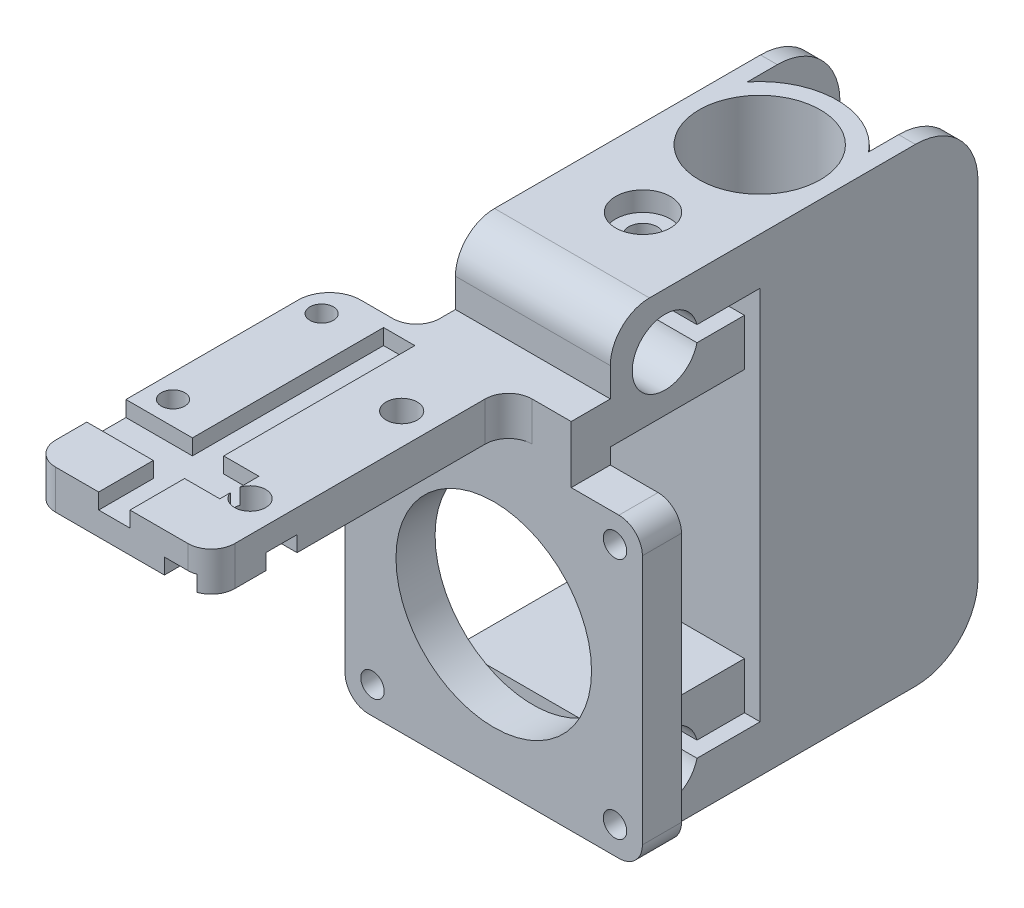
from build123d import *

# Parameters (mm, degrees)
SKETCH_1_W                = 15.5
SKETCH_1_H                = 11.302783866
EXTRUDE_1_DEPTH           = 60
SKETCH_2_R                = 4.2
CUT_EXTRUDE_1_DEPTH       = 90
CUT_EXTRUDE_2_DEPTH       = 40
SKETCH_4_W                = 15.5
SKETCH_4_H                = 19.5
SKETCH_4_H_2              = 7
CUT_EXTRUDE_3_DEPTH       = 6
FILLET_1_R                = 5
FILLET_2_R                = 8
SKETCH_13_R               = 1.8
CUT_EXTRUDE_9_DEPTH       = 75
SKETCH_8_W                = 19.8
SKETCH_8_H                = 7.315078523
SKETCH_8_H_2              = 8
EXTRUDE_3_DEPTH           = 5
SKETCH_10_R               = 12.5
SKETCH_10_R_2             = 1.5
CUT_EXTRUDE_6_DEPTH       = 5
FILLET_4_R                = 3
CUT_EXTRUDE_10_DEPTH      = 34
CUT_EXTRUDE_10_DEPTH_BACK = 2
SKETCH_15_R               = 3.5
CUT_EXTRUDE_11_DEPTH      = 2.5
CUT_EXTRUDE_START         = -2.5
SKETCH_16_R               = 3.5
CUT_EXTRUDE_12_DEPTH      = 2.5
SKETCH_17_W               = 22.9
SKETCH_17_H               = 5
EXTRUDE_4_DEPTH           = 38
SKETCH_18_R               = 1.5
SKETCH_18_R_2             = 2
CUT_EXTRUDE_13_DEPTH      = 36.5
CUT_EXTRUDE_14_DEPTH      = 2
FILLET_5_R                = 3
SKETCH_20_W               = 4.5
SKETCH_20_H               = 5
SKETCH_20_W_2             = 4
SKETCH_20_W_3             = 8.5
SKETCH_20_H_2             = 6.981759249
SKETCH_20_H_3             = 24.431763341
CUT_EXTRUDE_15_DEPTH      = 2
FILLET_6_R                = 4
SKETCH_22_W               = 4
SKETCH_22_H               = 4
SKETCH_22_H_2             = 8.955168194
CUT_EXTRUDE_16_DEPTH      = 2


with BuildPart() as part:
    # Эскиз1 → Бобышка-Вытянуть1 (new body)
    with BuildSketch(Plane(origin=(0, 0, 0), x_dir=(1, 0, 0), z_dir=(0, 1, 0))):
        with BuildLine():
            Line((7.75, 0), (7.75, 6.160154219))
            ThreePointArc((7.75, 6.160154219), (0, 9.9), (-7.75, 6.160154219))
            Line((-7.75, 6.160154219), (-7.75, -3.2e-08))
            ThreePointArc((-7.75, -3.2e-08), (-1.6e-08, 7.75), (7.75, 0))
        make_face()
        with BuildLine():
            ThreePointArc((0, -9.9), (4.302584876, -8.916151826), (7.75, -6.160154219))
            Line((7.75, -6.160154219), (7.75, 0))
            ThreePointArc((7.75, 0), (1.6e-08, -7.75), (-7.75, -3.2e-08))
            Line((-7.75, -3.2e-08), (-7.75, -6.160154219))
            ThreePointArc((-7.75, -6.160154219), (-4.302584876, -8.916151826), (0, -9.9))
        make_face()
        with BuildLine():
            ThreePointArc((7.75, 6.160154219), (9.347058361, 3.262284476), (9.9, 0))
            Line((9.9, 0), (9.9, 18))
            Line((9.9, 18), (-9.9, 18))
            Line((-9.9, 18), (-9.9, 0))
            ThreePointArc((-9.9, 0), (-9.347058361, 3.262284476), (-7.75, 6.160154219))
            Line((-7.75, 6.160154219), (-7.75, 14))
            Line((-7.75, 14), (7.75, 14))
            Line((7.75, 14), (7.75, 6.160154219))
        make_face()
        with BuildLine():
            ThreePointArc((7.75, -6.160154219), (9.347058361, -3.262284476), (9.9, 0))
            ThreePointArc((9.9, 0), (9.347058361, 3.262284476), (7.75, 6.160154219))
            Line((7.75, 6.160154219), (7.75, 0))
            Line((7.75, 0), (7.75, -6.160154219))
        make_face()
        with BuildLine():
            Line((-7.75, -3.2e-08), (-7.75, 6.160154219))
            ThreePointArc((-7.75, 6.160154219), (-9.347058361, 3.262284476), (-9.9, 0))
            ThreePointArc((-9.9, 0), (-9.347058361, -3.262284476), (-7.75, -6.160154219))
            Line((-7.75, -6.160154219), (-7.75, -3.2e-08))
        make_face()
        with BuildLine():
            Line((9.9, -29), (9.9, 0))
            ThreePointArc((9.9, 0), (9.347058361, -3.262284476), (7.75, -6.160154219))
            Line((7.75, -6.160154219), (7.75, -9.9))
            Line((7.75, -9.9), (7.75, -11.85))
            Line((7.75, -11.85), (7.75, -23.152783866))
            Line((7.75, -23.152783866), (-7.75, -23.152783866))
            Line((-7.75, -23.152783866), (-7.75, -11.85))
            Line((-7.75, -11.85), (-7.75, -9.9))
            Line((-7.75, -9.9), (-7.75, -6.160154219))
            ThreePointArc((-7.75, -6.160154219), (-9.347058361, -3.262284476), (-9.9, 0))
            Line((-9.9, 0), (-9.9, -29))
            Line((-9.9, -29), (9.9, -29))
        make_face()
        with Locations((0, -17.501391933)):
            Rectangle(SKETCH_1_W, SKETCH_1_H)
        Polygon((7.75, -11.85), (7.75, -9.9), (0, -9.9), (-7.75, -9.9), (-7.75, -11.85), align=None)
        with BuildLine():
            Line((7.75, -9.9), (7.75, -6.160154219))
            ThreePointArc((7.75, -6.160154219), (4.302584876, -8.916151826), (0, -9.9))
            Line((0, -9.9), (7.75, -9.9))
        make_face()
        with BuildLine():
            Line((-7.75, -9.9), (0, -9.9))
            ThreePointArc((0, -9.9), (-4.302584876, -8.916151826), (-7.75, -6.160154219))
            Line((-7.75, -6.160154219), (-7.75, -9.9))
        make_face()
    extrude(amount=EXTRUDE_1_DEPTH)

    # Эскиз2 → Вырез-Вытянуть1 (cut)
    with BuildSketch(Plane(origin=(9.9, 0, 0), x_dir=(0, 0, -1), z_dir=(1, 0, 0))):
        with Locations((-22, 53)):
            Circle(SKETCH_2_R)
        with Locations((-22, 7)):
            Circle(SKETCH_2_R)
    extrude(amount=-CUT_EXTRUDE_1_DEPTH, mode=Mode.SUBTRACT)

    # Эскиз3 → Вырез-Вытянуть2 (cut)
    with BuildSketch(Plane(origin=(9.9, 0, 0), x_dir=(0, 0, -1), z_dir=(1, 0, 0))):
        Polygon((-29, 46), (-29, 14), (-11.85, 14), (-11.85, 8), (-22, 8), (-22, 6), (-9.85, 6), (-9.85, 54), (-22, 54), (-22, 52), (-11.85, 52), (-11.85, 46), align=None)
    extrude(amount=-CUT_EXTRUDE_2_DEPTH, mode=Mode.SUBTRACT)

    # Эскиз4 → Вырез-Вытянуть3 (cut)
    with BuildSketch(Plane(origin=(0, 0, -18), x_dir=(-1, 0, 0), z_dir=(0, 0, -1))):
        with Locations((0, 50.25)):
            Rectangle(SKETCH_4_W, SKETCH_4_H)
        with Locations((0, 30)):
            Rectangle(SKETCH_4_W, SKETCH_4_H_2)
        with Locations((0, 9.75)):
            Rectangle(SKETCH_4_W, SKETCH_4_H)
    extrude(amount=-CUT_EXTRUDE_3_DEPTH, mode=Mode.SUBTRACT)

    # Скругление1
    fillet_1_edges = [part.edges().sort_by_distance(p)[0] for p in [
        (0, 60, 29),
        (0, 0, 29),
    ]]
    fillet(fillet_1_edges, radius=FILLET_1_R)

    # Скругление2
    fillet_2_edges = [part.edges().sort_by_distance(p)[0] for p in [
        (-8.825, 60, -18),
        (-8.825, 0, -18),
        (8.825, 0, -18),
        (8.825, 60, -18),
    ]]
    fillet(fillet_2_edges, radius=FILLET_2_R)

    # Эскиз13 → Вырез-Вытянуть9 (cut)
    with BuildSketch(Plane.XZ):
        with Locations(Location((0, 14.920784389, 0), (0, 0, 270))):
            Circle(SKETCH_13_R)
    extrude(amount=-CUT_EXTRUDE_9_DEPTH, mode=Mode.SUBTRACT)

    # Эскиз8 → Бобышка-Вытянуть3 (add)
    with BuildSketch(Plane.XY.offset(29)):
        Polygon((-9.9, 44), (-19, 44), (-19, 6), (-9.9, 6), (-9.9, 14), (9.9, 14), (9.9, 6), (19, 6), (19, 44), (9.9, 44), align=None)
        with Locations((0, 47.657539262)):
            Rectangle(SKETCH_8_W, SKETCH_8_H)
        with Locations((0, 10)):
            Rectangle(SKETCH_8_W, SKETCH_8_H_2)
    extrude(amount=EXTRUDE_3_DEPTH)

    # Эскиз10 → Вырез-Вытянуть6 (cut)
    with BuildSketch(Plane.XY.offset(34)):
        with Locations((0, 25)):
            Circle(SKETCH_10_R)
        with Locations((-15.5, 9.5)):
            Circle(SKETCH_10_R_2)
        with Locations((-15.5, 40.5)):
            Circle(SKETCH_10_R_2)
        with Locations((15.5, 9.5)):
            Circle(SKETCH_10_R_2)
        with Locations((15.5, 40.5)):
            Circle(SKETCH_10_R_2)
    extrude(amount=-CUT_EXTRUDE_6_DEPTH, mode=Mode.SUBTRACT)

    # Скругление4
    fillet_4_edges = [part.edges().sort_by_distance(p)[0] for p in [
        (-19, 6, 31.5),
        (19, 6, 31.5),
        (19, 44, 31.5),
        (-19, 44, 31.5),
    ]]
    fillet(fillet_4_edges, radius=FILLET_4_R)

    # Эскиз14 → Вырез-Вытянуть10 (cut, two sides: drawn at the far end of the back side and taken through both)
    with BuildSketch(Plane(origin=(0, 14, 0), x_dir=(1, 0, 0), z_dir=(0, 1, 0)).offset(-CUT_EXTRUDE_10_DEPTH_BACK)):
        Polygon((-1.772918194, -17.991568778), (1.772918194, -17.991568778), (3.545836387, -14.920784389), (1.772918194, -11.85), (-1.772918194, -11.85), (-3.545836387, -14.920784389), align=None)
    extrude(amount=CUT_EXTRUDE_10_DEPTH + CUT_EXTRUDE_10_DEPTH_BACK, mode=Mode.SUBTRACT)

    # Эскиз15 → Вырез-Вытянуть11 (cut)
    with BuildSketch(Plane(origin=(0, 60, 0), x_dir=(1, 0, 0), z_dir=(0, 1, 0))):
        with Locations(Location((0, -14.920784389, 0), (0, 0, 270))):
            Circle(SKETCH_15_R)
    extrude(amount=-CUT_EXTRUDE_11_DEPTH, mode=Mode.SUBTRACT)

    # Эскиз16 → Вырез-Вытянуть12 (cut)
    with BuildSketch(Plane.XZ.offset(CUT_EXTRUDE_START)):
        with Locations(Location((0, 14.920784389, 0), (0, 0, 90))):
            Circle(SKETCH_16_R)
    extrude(amount=CUT_EXTRUDE_12_DEPTH, mode=Mode.SUBTRACT)

    # Эскиз17 → Бобышка-Вытянуть4 (add)
    with BuildSketch(Plane.XY.offset(34)):
        with Locations((-9.55, 48.815078523)):
            Rectangle(SKETCH_17_W, SKETCH_17_H)
    extrude(amount=EXTRUDE_4_DEPTH)

    # Эскиз18 → Вырез-Вытянуть13 (cut)
    with BuildSketch(Plane(origin=(0, 51.315078523, 0), x_dir=(1, 0, 0), z_dir=(0, 1, 0))):
        with Locations(Location((-18, -57, 0), (0, 0, 270))):
            Circle(SKETCH_18_R)
        with Locations(Location((-18, -38, 0), (0, 0, 270))):
            Circle(SKETCH_18_R)
        with Locations(Location((-2.1, -63.044831806, 0), (0, 0, 270))):
            Circle(SKETCH_18_R_2)
        with Locations(Location((-2.1, -43.673036669, 0), (0, 0, 270))):
            Circle(SKETCH_18_R_2)
    extrude(amount=-CUT_EXTRUDE_13_DEPTH, mode=Mode.SUBTRACT)

    # Эскиз19 → Вырез-Вытянуть14 (cut)
    with BuildSketch(Plane.XZ.offset(-46.315078523)):
        Polygon((-18, 61.041451884), (-21.5, 59.020725942), (-21.5, 54.979274058), (-18, 52.958548116), (-14.5, 54.979274058), (-14.5, 59.020725942), align=None)
        Polygon((-18, 42.041451884), (-21.5, 40.020725942), (-21.5, 35.979274058), (-18, 33.958548116), (-14.5, 35.979274058), (-14.5, 40.020725942), align=None)
    extrude(amount=-CUT_EXTRUDE_14_DEPTH, mode=Mode.SUBTRACT)

    # Скругление5
    fillet_5_edges = [part.edges().sort_by_distance(p)[0] for p in [
        (-9.9, 48.815078523, 34),
        (1.9, 48.815078523, 34),
        (1.9, 48.815078523, 72),
        (-21, 48.815078523, 72),
    ]]
    fillet(fillet_5_edges, radius=FILLET_5_R)

    # Эскиз20 → Вырез-Вытянуть15 (cut)
    with BuildSketch(Plane(origin=(0, 51.315078523, 0), x_dir=(1, 0, 0), z_dir=(0, 1, 0))):
        with Locations((-6.25, -62.518240751)):
            Rectangle(SKETCH_20_W, SKETCH_20_H)
        with Locations((-10.5, -62.518240751)):
            Rectangle(SKETCH_20_W_2, SKETCH_20_H)
        with Locations((-16.75, -62.518240751)):
            Rectangle(SKETCH_20_W_3, SKETCH_20_H)
        with Locations((-10.5, -68.509120376)):
            Rectangle(SKETCH_20_W_2, SKETCH_20_H_2)
        with Locations((-10.5, -47.80235908)):
            Rectangle(SKETCH_20_W_2, SKETCH_20_H_3)
    extrude(amount=-CUT_EXTRUDE_15_DEPTH, mode=Mode.SUBTRACT)

    # Скругление6
    # the kernel refuses this fillet: 4 mm, written as the material it takes off along each edge
    with BuildSketch(Plane(origin=(-21, 61.315078523, 34), x_dir=(1, 0, 0), z_dir=(0, -1, 0))) as fillet_6_piece_1:
        with BuildLine():
            CenterArc((FILLET_6_R, FILLET_6_R), FILLET_6_R, 180, 90)
            Line((0, FILLET_6_R), (0, 0))
            Line((0, 0), (FILLET_6_R, 0))
        make_face()
    extrude(amount=25, mode=Mode.SUBTRACT)

    # Эскиз22 → Вырез-Вытянуть16 (cut)
    with BuildSketch(Plane.XZ.offset(-46.315078523)):
        with Locations((-0.1, 63.044831806)):
            Rectangle(SKETCH_22_W, SKETCH_22_H)
        with Locations((-2.1, 67.522415903)):
            Rectangle(SKETCH_22_W, SKETCH_22_H_2)
    extrude(amount=-CUT_EXTRUDE_16_DEPTH, mode=Mode.SUBTRACT)


solid = part.part
